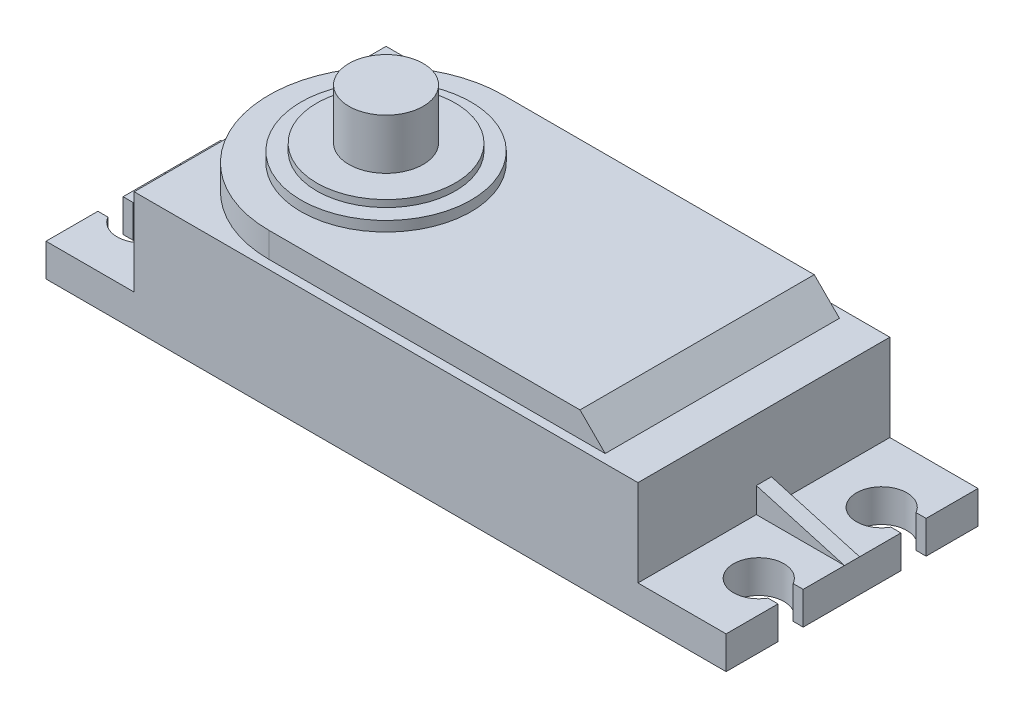
from build123d import *

# Parameters (mm, degrees)
CROQUIS_BASE_W           = 54
CROQUIS_BASE_H           = 20
SALIENTE_EXTRUIR1_DEPTH  = 2.6
CORTAR_EXTRUIR1_DEPTH    = 2.6
CROQUIS_STEP_2_3_W       = 40
CROQUIS_STEP_2_3_H       = 20
SALIENTE_EXTRUIR2_DEPTH  = 6.9
SALIENTE_EXTRUIR5_DEPTH  = 2
CROQUIS5_W               = 7
CROQUIS5_H               = 1.2
SALIENTE_EXTRUIR6_DEPTH  = 2
CROQUIS3_W               = 7
CROQUIS3_H               = 1.2
SALIENTE_EXTRUIR7_DEPTH  = 2
CORTAR_EXTRUIR4_DEPTH    = 1.2
CORTAR_EXTRUIR5_DEPTH    = 1.2
CROQUIS10_R              = 6.75
SALIENTE_EXTRUIR8_DEPTH  = 0.8
CROQUIS11_R              = 5.5
SALIENTE_EXTRUIR9_DEPTH  = 0.55
CHAFL_N1_START           = 18.526197667
CHAFL_N1_OUTLINE_W       = 2.828427125
CHAFL_N1_OUTLINE_H       = 18.6
CHAFL_N1_DEPTH           = 2.473802333
CROQUIS12_R              = 2.95
SALIENTE_EXTRUIR10_DEPTH = 4


with BuildPart() as part:
    # Croquis base → Saliente-Extruir1 (new body)
    with BuildSketch(Plane(origin=(0, 0, 0), x_dir=(1, 0, 0), z_dir=(0, 1, 0))):
        Rectangle(CROQUIS_BASE_W, CROQUIS_BASE_H)
    extrude(amount=SALIENTE_EXTRUIR1_DEPTH)

    # Croquis step 2 → Cortar-Extruir1 (cut)
    with BuildSketch(Plane(origin=(0, 2.6, 0), x_dir=(1, 0, 0), z_dir=(0, 1, 0))):
        with BuildLine():
            Line((-26.204050808, 5.88), (-27, 5.88))
            Line((-27, 5.88), (-27, 3.88))
            Line((-27, 3.88), (-26.204050808, 3.88))
            ThreePointArc((-26.204050808, 3.88), (-22.472, 4.88), (-26.204050808, 5.88))
        make_face()
        with BuildLine():
            Line((-26.204050808, -3.88), (-27, -3.88))
            Line((-27, -3.88), (-27, -5.88))
            Line((-27, -5.88), (-26.204050808, -5.88))
            ThreePointArc((-26.204050808, -5.88), (-22.472, -4.88), (-26.204050808, -3.88))
        make_face()
        with BuildLine():
            Line((26.204050808, 3.88), (27, 3.88))
            Line((27, 3.88), (27, 5.88))
            Line((27, 5.88), (26.204050808, 5.88))
            ThreePointArc((26.204050808, 5.88), (22.472, 4.88), (26.204050808, 3.88))
        make_face()
        with BuildLine():
            Line((26.204050808, -5.88), (27, -5.88))
            Line((27, -5.88), (27, -3.88))
            Line((27, -3.88), (26.204050808, -3.88))
            ThreePointArc((26.204050808, -3.88), (22.472, -4.88), (26.204050808, -5.88))
        make_face()
    extrude(amount=-CORTAR_EXTRUIR1_DEPTH, mode=Mode.SUBTRACT)

    # Croquis step 2<3> → Saliente-Extruir2 (add)
    with BuildSketch(Plane(origin=(0, 2.6, 0), x_dir=(1, 0, 0), z_dir=(0, 1, 0))):
        Rectangle(CROQUIS_STEP_2_3_W, CROQUIS_STEP_2_3_H)
    extrude(amount=SALIENTE_EXTRUIR2_DEPTH)

    # Croquis7 → Saliente-Extruir5 (add)
    with BuildSketch(Plane(origin=(0, 9.5, 0), x_dir=(1, 0, 0), z_dir=(0, 1, 0))):
        with BuildLine():
            Line((-10, 9.3), (16.7, 9.3))
            Line((16.7, 9.3), (16.7, -9.3))
            Line((16.7, -9.3), (-10, -9.3))
            ThreePointArc((-10, -9.3), (-19.3, 0), (-10, 9.3))
        make_face()
    extrude(amount=SALIENTE_EXTRUIR5_DEPTH)

    # Croquis5 → Saliente-Extruir6 (add)
    with BuildSketch(Plane(origin=(0, 2.6, 0), x_dir=(1, 0, 0), z_dir=(0, 1, 0))):
        with Locations((23.5, 0)):
            Rectangle(CROQUIS5_W, CROQUIS5_H)
    extrude(amount=SALIENTE_EXTRUIR6_DEPTH)

    # Croquis3 → Saliente-Extruir7 (add)
    with BuildSketch(Plane(origin=(0, 2.6, 0), x_dir=(1, 0, 0), z_dir=(0, 1, 0))):
        with Locations((-23.5, 0)):
            Rectangle(CROQUIS3_W, CROQUIS3_H)
    extrude(amount=SALIENTE_EXTRUIR7_DEPTH)

    # Croquis8 → Cortar-Extruir4 (cut)
    with BuildSketch(Plane.XY.offset(0.6)):
        Polygon((-27, 2.6), (-27, 4.6), (-20, 4.6), align=None)
    extrude(amount=-CORTAR_EXTRUIR4_DEPTH, mode=Mode.SUBTRACT)

    # Croquis9 → Cortar-Extruir5 (cut)
    with BuildSketch(Plane.XY.offset(0.6)):
        Polygon((27, 2.6), (20, 4.6), (27, 4.6), align=None)
    extrude(amount=-CORTAR_EXTRUIR5_DEPTH, mode=Mode.SUBTRACT)

    # Croquis10 → Saliente-Extruir8 (add)
    with BuildSketch(Plane(origin=(0, 11.5, 0), x_dir=(1, 0, 0), z_dir=(0, 1, 0))):
        with Locations(Location((-10, 0, 0), (0, 0, 270))):
            Circle(CROQUIS10_R)
    extrude(amount=SALIENTE_EXTRUIR8_DEPTH)

    # Croquis11 → Saliente-Extruir9 (add)
    with BuildSketch(Plane(origin=(0, 12.3, 0), x_dir=(1, 0, 0), z_dir=(0, 1, 0))):
        with Locations(Location((-10, 0, 0), (0, 0, 270))):
            Circle(CROQUIS11_R)
    extrude(amount=SALIENTE_EXTRUIR9_DEPTH)

    # Chaflán1: read off the stored shape, not the designer's step
    # Chaflán1 outline → Chaflán1 (cut)
    with BuildSketch(Plane(origin=(0, 0, 0), x_dir=(0.707106781186548, -0.707106781186547, 0), z_dir=(0.707106781186547, 0.707106781186548, 0)).offset(CHAFL_N1_START)):
        with Locations((3.676955263, 0)):
            Rectangle(CHAFL_N1_OUTLINE_W, CHAFL_N1_OUTLINE_H)
    extrude(amount=CHAFL_N1_DEPTH, mode=Mode.SUBTRACT)

    # Croquis12 → Saliente-Extruir10 (add)
    with BuildSketch(Plane(origin=(0, 12.85, 0), x_dir=(1, 0, 0), z_dir=(0, 1, 0))):
        with Locations(Location((-10, 0, 0), (0, 0, 270))):
            Circle(CROQUIS12_R)
    extrude(amount=SALIENTE_EXTRUIR10_DEPTH)


solid = part.part
